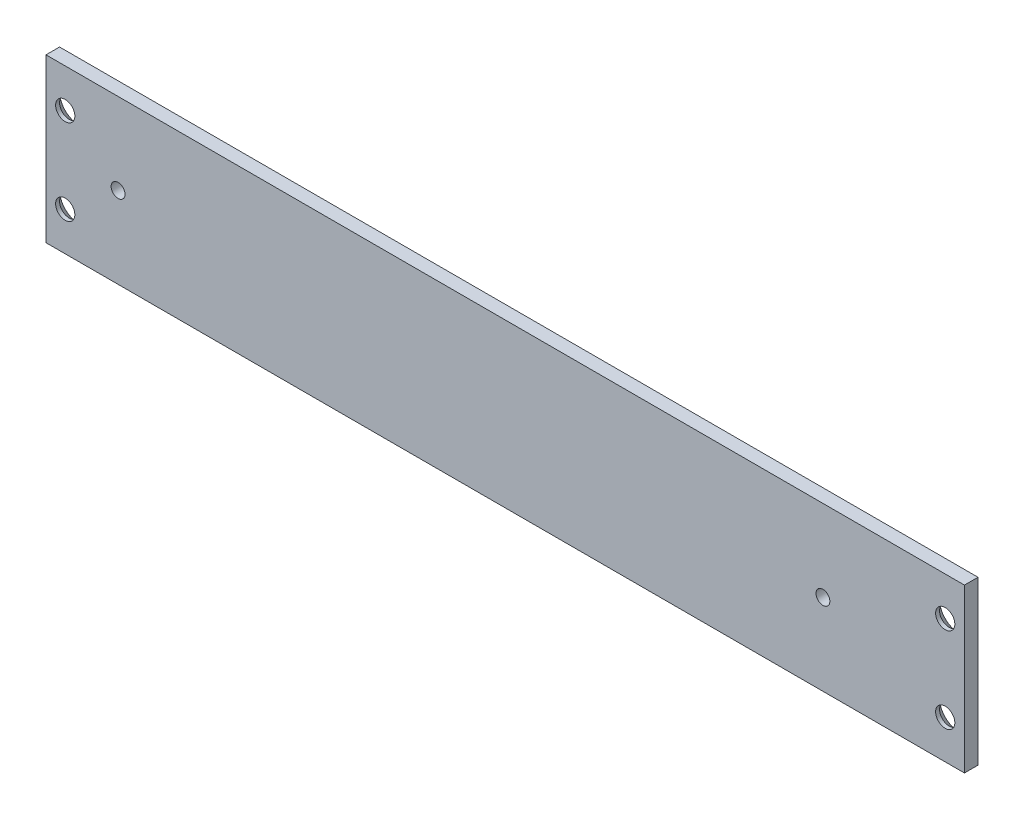
from build123d import *

# Parameters (mm, degrees)
SKETCH1_W           = 430
SKETCH1_H           = 76.2
SKETCH1_R           = 4.5
SKETCH1_R_2         = 3.25
BOSS_EXTRUDE1_DEPTH = 6.35
CHAMFER1_SIZE       = 4.5


with BuildPart() as part:
    # Sketch1 → Boss-Extrude1 (new body)
    with BuildSketch(Plane.XY):
        with Locations((215, 38.1)):
            Rectangle(SKETCH1_W, SKETCH1_H)
        with Locations((9, 58.1)):
            Circle(SKETCH1_R, mode=Mode.SUBTRACT)
        with Locations(Location((9, 18.1, 0), (0, 0, 180))):
            Circle(SKETCH1_R, mode=Mode.SUBTRACT)
        with Locations((421, 18.1)):
            Circle(SKETCH1_R, mode=Mode.SUBTRACT)
        with Locations(Location((421, 58.1, 0), (0, 0, 180))):
            Circle(SKETCH1_R, mode=Mode.SUBTRACT)
        with Locations((33.75, 38.1)):
            Circle(SKETCH1_R_2, mode=Mode.SUBTRACT)
        with Locations((363.75, 38.1)):
            Circle(SKETCH1_R_2, mode=Mode.SUBTRACT)
    extrude(amount=BOSS_EXTRUDE1_DEPTH)

    # Chamfer1
    chamfer1_edges = [part.edges().sort_by_distance(p)[0] for p in [
        (4.5, 58.1, 0),
        (13.5, 18.1, 0),
        (416.5, 18.1, 0),
        (425.5, 58.1, 0),
    ]]
    chamfer(chamfer1_edges, length=CHAMFER1_SIZE - 0.0001)  # a hair under: the kernel refuses the full size


solid = part.part
